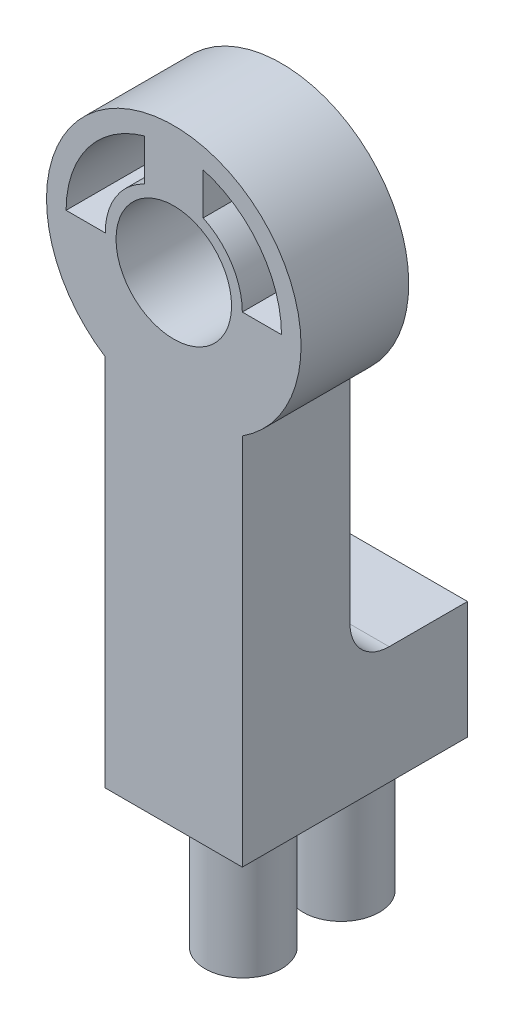
from build123d import *
from build123d.topology import SkipClean

# Parameters (mm, degrees)
SKETCH1_R               = 2.95
BOSS_EXTRUDE1_DEPTH     = 3.7
CUT_EXTRUDE1_DEPTH      = 10
CUT_EXTRUDE1_DEPTH_BACK = 10
SKETCH2_W               = 0.6
SKETCH2_H               = 16.95
SKETCH3_R               = 2.95
SKETCH3_R_2             = 1.5
BOSS_EXTRUDE2_DEPTH     = 3.1
SKETCH4_R               = 2.5
CUT_EXTRUDE2_DEPTH      = 1.5
SKETCH5_R               = 1.5
BOSS_EXTRUDE3_DEPTH     = 0.4
SKETCH6_R               = 2.95
BOSS_EXTRUDE4_DEPTH     = 2.4
SKETCH7_W               = 22.104564564
SKETCH7_H               = 50.546801486
CUT_EXTRUDE3_DEPTH      = 0.6
SKETCH8_R               = 1.5
BOSS_EXTRUDE5_DEPTH     = 2.6
BOSS_EXTRUDE6_START     = -5.5
SKETCH9_R               = 5.5
SKETCH9_R_2             = 3.5
BOSS_EXTRUDE6_DEPTH     = 5.5
SKETCH10_W              = 7
SKETCH10_H              = 7
CUT_EXTRUDE4_DEPTH      = 5.5
SKETCH11_W              = 20.865326807
SKETCH11_H              = 17.809349761
CUT_EXTRUDE5_DEPTH      = 10
SKETCH12_W              = 7
SKETCH12_H              = 6
BOSS_EXTRUDE7_DEPTH     = 6
FILLET1_R               = 2
SKETCH13_R              = 1.95
BOSS_EXTRUDE8_DEPTH     = 7


with BuildPart() as part:
    # Sketch1 → Boss-Extrude1 (new body)
    with BuildSketch(Plane.XY):
        with BuildLine():
            Line((-3.5, -5.477225575), (-3.5, -29.522774425))
            ThreePointArc((-3.5, -29.522774425), (0, -41.5), (3.5, -29.522774425))
            Line((3.5, -29.522774425), (3.5, -5.477225575))
            ThreePointArc((3.5, -5.477225575), (0, 6.5), (-3.5, -5.477225575))
        make_face()
        with BuildLine():
            Line((-3.5, 0), (-5.5, 0))
            ThreePointArc((-5.5, 0), (-4.387482194, 3.31662479), (-1.5, 5.291502622))
            Line((-1.5, 5.291502622), (-1.5, 3.16227766))
            ThreePointArc((-1.5, 3.16227766), (-2.958039892, 1.870828693), (-3.5, 0))
        make_face(mode=Mode.SUBTRACT)
        with BuildLine():
            ThreePointArc((1.5, 5.291502622), (4.387482194, 3.31662479), (5.5, 0))
            Line((5.5, 0), (3.5, 0))
            ThreePointArc((3.5, 0), (2.958039892, 1.870828693), (1.5, 3.16227766))
            Line((1.5, 3.16227766), (1.5, 5.291502622))
        make_face(mode=Mode.SUBTRACT)
        Circle(SKETCH1_R, mode=Mode.SUBTRACT)
        with BuildLine():
            ThreePointArc((-1.5, -40.291502622), (-4.387482194, -38.31662479), (-5.5, -35))
            Line((-5.5, -35), (-3.5, -35))
            ThreePointArc((-3.5, -35), (-2.958039892, -36.870828693), (-1.5, -38.16227766))
            Line((-1.5, -38.16227766), (-1.5, -40.291502622))
        make_face(mode=Mode.SUBTRACT)
        with BuildLine():
            ThreePointArc((5.5, -35), (4.387482194, -38.31662479), (1.5, -40.291502622))
            Line((1.5, -40.291502622), (1.5, -38.16227766))
            ThreePointArc((1.5, -38.16227766), (2.958039892, -36.870828693), (3.5, -35))
            Line((3.5, -35), (5.5, -35))
        make_face(mode=Mode.SUBTRACT)
        with Locations((0, -35)):
            Circle(SKETCH1_R, mode=Mode.SUBTRACT)
    extrude(amount=BOSS_EXTRUDE1_DEPTH)

    # Sketch2 → Cut-Extrude1 (cut, two sides: drawn at the far end of the back side and taken through both)
    with BuildSketch(Plane(origin=(0, 0, 0), x_dir=(0, 0, -1), z_dir=(1, 0, 0)).offset(-CUT_EXTRUDE1_DEPTH_BACK)):
        with Locations((-3.4, -33.025)):
            Rectangle(SKETCH2_W, SKETCH2_H)
    extrude(amount=CUT_EXTRUDE1_DEPTH + CUT_EXTRUDE1_DEPTH_BACK, mode=Mode.SUBTRACT)

    # Sketch3 → Boss-Extrude2 (add)
    with BuildSketch(Plane(origin=(0, 0, 0), x_dir=(-1, 0, 0), z_dir=(0, 0, -1))):
        with Locations((0, -35)):
            Circle(SKETCH3_R)
        with Locations((0, -35)):
            Circle(SKETCH3_R_2, mode=Mode.SUBTRACT)
    extrude(amount=-BOSS_EXTRUDE2_DEPTH)

    # Sketch4 → Cut-Extrude2 (cut)
    with BuildSketch(Plane(origin=(0, 0, 0), x_dir=(-1, 0, 0), z_dir=(0, 0, -1))):
        with Locations((0, -35)):
            Circle(SKETCH4_R)
    extrude(amount=-CUT_EXTRUDE2_DEPTH, mode=Mode.SUBTRACT)

    # Sketch5 → Boss-Extrude3 (add)
    with SkipClean():  # the faces are left unmerged after this step: merging them gives an invalid solid
        with BuildSketch(Plane.XY.offset(3.1)):
            with BuildLine():
                Line((3.5, -24.55), (-3.5, -24.55))
                Line((-3.5, -24.55), (-3.5, -29.522774425))
                ThreePointArc((-3.5, -29.522774425), (0, -41.5), (3.5, -29.522774425))
                Line((3.5, -29.522774425), (3.5, -24.55))
            make_face()
            with BuildLine():
                Line((-5.5, -35), (-3.5, -35))
                ThreePointArc((-3.5, -35), (-2.958039892, -36.870828693), (-1.5, -38.16227766))
                Line((-1.5, -38.16227766), (-1.5, -40.291502622))
                ThreePointArc((-1.5, -40.291502622), (-4.387482194, -38.31662479), (-5.5, -35))
            make_face(mode=Mode.SUBTRACT)
            with BuildLine():
                ThreePointArc((5.5, -35), (4.387482194, -38.31662479), (1.5, -40.291502622))
                Line((1.5, -40.291502622), (1.5, -38.16227766))
                ThreePointArc((1.5, -38.16227766), (2.958039892, -36.870828693), (3.5, -35))
                Line((3.5, -35), (5.5, -35))
            make_face(mode=Mode.SUBTRACT)
            with Locations((0, -35)):
                Circle(SKETCH5_R, mode=Mode.SUBTRACT)
        extrude(amount=BOSS_EXTRUDE3_DEPTH)

    # Sketch6 → Boss-Extrude4 (add)
    with SkipClean():  # the faces are left unmerged after this step: merging them gives an invalid solid
        with BuildSketch(Plane.XY.offset(3.7)):
            with BuildLine():
                Line((-3.5, -5.477225575), (-3.5, -24.55))
                Line((-3.5, -24.55), (3.5, -24.55))
                Line((3.5, -24.55), (3.5, -5.477225575))
                ThreePointArc((3.5, -5.477225575), (0, 6.5), (-3.5, -5.477225575))
            make_face()
            Circle(SKETCH6_R, mode=Mode.SUBTRACT)
            with BuildLine():
                Line((-1.5, 5.291502622), (-1.5, 3.16227766))
                ThreePointArc((-1.5, 3.16227766), (-2.958039892, 1.870828693), (-3.5, 0))
                Line((-3.5, 0), (-5.5, 0))
                ThreePointArc((-5.5, 0), (-4.387482194, 3.31662479), (-1.5, 5.291502622))
            make_face(mode=Mode.SUBTRACT)
            with BuildLine():
                Line((1.5, 5.291502622), (1.5, 3.16227766))
                ThreePointArc((1.5, 3.16227766), (2.958039892, 1.870828693), (3.5, 0))
                Line((3.5, 0), (5.5, 0))
                ThreePointArc((5.5, 0), (4.387482194, 3.31662479), (1.5, 5.291502622))
            make_face(mode=Mode.SUBTRACT)
        extrude(amount=BOSS_EXTRUDE4_DEPTH)

    # Sketch7 → Cut-Extrude3 (cut)
    with SkipClean():  # the faces are left unmerged after this step: merging them gives an invalid solid
        with BuildSketch(Plane.XY):
            with Locations((0.952758093, -17.453923436)):
                Rectangle(SKETCH7_W, SKETCH7_H)
        extrude(amount=CUT_EXTRUDE3_DEPTH, mode=Mode.SUBTRACT)

    # Sketch8 → Boss-Extrude5 (add)
    with BuildSketch(Plane.XY.offset(3.5)):
        with BuildLine():
            Line((3.5, -29.522774425), (3.5, -24.55))
            Line((3.5, -24.55), (-3.5, -24.55))
            Line((-3.5, -24.55), (-3.5, -29.522774425))
            ThreePointArc((-3.5, -29.522774425), (0, -41.5), (3.5, -29.522774425))
        make_face()
        with BuildLine():
            Line((1.5, -40.291502622), (1.5, -38.16227766))
            ThreePointArc((1.5, -38.16227766), (2.958039892, -36.870828693), (3.5, -35))
            Line((3.5, -35), (5.5, -35))
            ThreePointArc((5.5, -35), (4.387482194, -38.31662479), (1.5, -40.291502622))
        make_face(mode=Mode.SUBTRACT)
        with BuildLine():
            Line((-1.5, -38.16227766), (-1.5, -40.291502622))
            ThreePointArc((-1.5, -40.291502622), (-4.387482194, -38.31662479), (-5.5, -35))
            Line((-5.5, -35), (-3.5, -35))
            ThreePointArc((-3.5, -35), (-2.958039892, -36.870828693), (-1.5, -38.16227766))
        make_face(mode=Mode.SUBTRACT)
        with Locations((0, -35)):
            Circle(SKETCH8_R, mode=Mode.SUBTRACT)
    extrude(amount=BOSS_EXTRUDE5_DEPTH)

    # Sketch9 → Boss-Extrude6 (add)
    with BuildSketch(Plane.XY.offset(6.1).offset(BOSS_EXTRUDE6_START)):
        with Locations((0, -35)):
            Circle(SKETCH9_R)
        with Locations((0, -35)):
            Circle(SKETCH9_R_2, mode=Mode.SUBTRACT)
    extrude(amount=BOSS_EXTRUDE6_DEPTH)

    # Sketch10 → Cut-Extrude4 (cut)
    with BuildSketch(Plane.XY.offset(6.1)):
        with Locations((0, -35)):
            Rectangle(SKETCH10_W, SKETCH10_H)
    extrude(amount=-CUT_EXTRUDE4_DEPTH, mode=Mode.SUBTRACT)

    # Sketch11 → Cut-Extrude5 (cut)
    with BuildSketch(Plane.XY.offset(6.1)):
        with Locations((0.447606021, -33.454674881)):
            Rectangle(SKETCH11_W, SKETCH11_H)
    extrude(amount=-CUT_EXTRUDE5_DEPTH, mode=Mode.SUBTRACT)

    # Sketch12 → Boss-Extrude7 (add)
    with BuildSketch(Plane.XZ.offset(24.55)):
        with Locations((0, -2.4)):
            Rectangle(SKETCH12_W, SKETCH12_H)
    extrude(amount=-BOSS_EXTRUDE7_DEPTH)

    # Fillet1
    fillet1_edges = [part.edges().sort_by_distance(p)[0] for p in [
        (0, -18.55, 0.6),
    ]]
    fillet(fillet1_edges, radius=FILLET1_R)

    # Sketch13 → Boss-Extrude8 (add)
    with BuildSketch(Plane.XZ.offset(24.55)):
        with Locations((0.05, 2.6)):
            Circle(SKETCH13_R)
        with Locations((0.05, -2.4)):
            Circle(SKETCH13_R)
    extrude(amount=BOSS_EXTRUDE8_DEPTH)


solid = part.part
